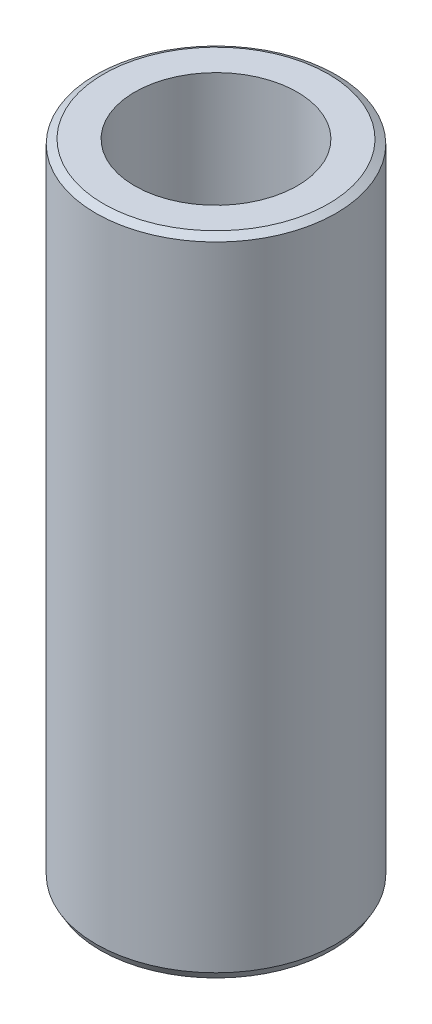
from build123d import *
from OCP.BRepFilletAPI import BRepFilletAPI_MakeChamfer

# Parameters (mm, degrees)
SKETCH1_R           = 60
BOSS_EXTRUDE1_DEPTH = 322.279019366
SKETCH2_R           = 40.627902378
CUT_EXTRUDE1_DEPTH  = 334.262308585
CHAMFER1_SIZE       = 2.193990042
CHAMFER1_SIZE2      = 3.800102224


with BuildPart() as part:
    # Sketch1 → Boss-Extrude1 (new body)
    with BuildSketch(Plane(origin=(0, 0, 0), x_dir=(1, 0, 0), z_dir=(0, 1, 0))):
        Circle(SKETCH1_R)
    extrude(amount=BOSS_EXTRUDE1_DEPTH)

    # Sketch2 → Cut-Extrude1 (cut, through all)
    with BuildSketch(Plane(origin=(0, 0, 0), x_dir=(1, 0, 0), z_dir=(0, 1, 0))):
        Circle(SKETCH2_R)
    extrude(amount=CUT_EXTRUDE1_DEPTH, mode=Mode.SUBTRACT)

    # Chamfer1: one chamfer whose edges measure the first distance from different faces: ONE call of the kernel's chamfer builder (chamfer() names one face for all edges)
    chamfer1_edges_1 = [part.edges().sort_by_distance(p)[0] for p in [
        (-60, 322.279019366, 0),
    ]]
    chamfer1_side_1 = [part.faces().sort_by_distance(p)[0] for p in [
        (-60, 161.139509683, 0),
    ]]
    chamfer1_edges_2 = [part.edges().sort_by_distance(p)[0] for p in [
        (-60, 0, 0),
    ]]
    chamfer1_side_2 = [part.faces().sort_by_distance(p)[0] for p in [
        (-58.302943725, 0, 0),
    ]]
    chamfer1 = BRepFilletAPI_MakeChamfer(part.part.solid().wrapped)
    for e in chamfer1_edges_1:
        chamfer1.Add(CHAMFER1_SIZE, CHAMFER1_SIZE2, e.wrapped, chamfer1_side_1[0].wrapped)  # the first distance lies on this face
    for e in chamfer1_edges_2:
        chamfer1.Add(CHAMFER1_SIZE, CHAMFER1_SIZE2, e.wrapped, chamfer1_side_2[0].wrapped)  # the first distance lies on this face
    add(Compound.cast(chamfer1.Shape()), mode=Mode.REPLACE)


solid = part.part
